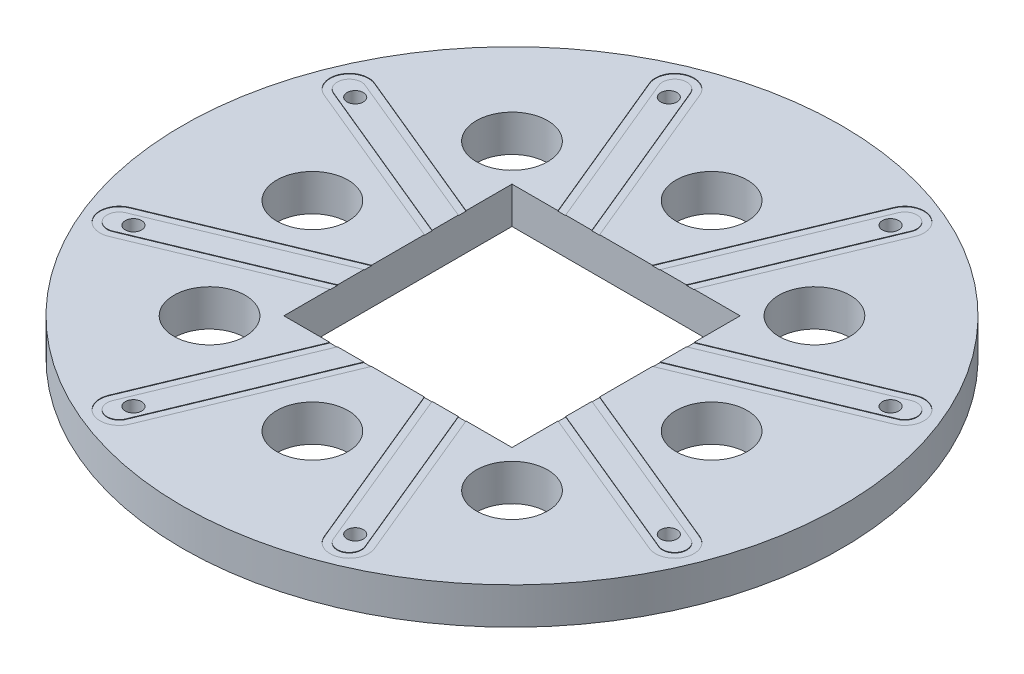
from build123d import *

# Parameters (mm, degrees)
BODAY_SKETCH_R    = 11.557
BODY_DEPTH        = 1.27
COPPER_START      = 0.017500092
COPPER_SKETCH_R   = 11.557
COPPER_DEPTH      = 0.017500092
GAP_CUT_DEPTH     = 17.39333395
CENTER_DEPTH      = 0.017500092
IO_HOLE_SKETCH_R  = 0.287000061
IO_HOLE_DEPTH     = 17.39333395
GAP_CUTS_COUNT    = 8
CENTERS_COUNT     = 8
IO_HOLES_COUNT    = 8
POCKET_DEPTH      = 17.39333395
POCKET_DEPTH_BACK = 17.39333395
POCKET_SKETCH_W   = 8.000000002
POCKET_SKETCH_H   = 8.000000002
POSTS_R           = 1.25000004
POST_CUT_DEPTH    = 17.39333395
POST_CUTS_COUNT   = 4


with BuildPart() as part:
    # Boday Sketch → Body (new body)
    with BuildSketch(Plane(origin=(0, 0, 0), x_dir=(1, 0, 0), z_dir=(0, 1, 0))):
        Circle(BODAY_SKETCH_R)
    extrude(amount=-BODY_DEPTH)

    # Copper Sketch → Copper (add)
    with BuildSketch(Plane(origin=(0, 0, 0), x_dir=(1, 0, 0), z_dir=(0, 1, 0)).offset(COPPER_START)):
        Circle(COPPER_SKETCH_R)
    extrude(amount=-COPPER_DEPTH)

    # Gap → Gap Cut (cut, through all)
    with BuildSketch(Plane(origin=(0, 0, 0), x_dir=(1, 0, 0), z_dir=(0, 1, 0))):
        with BuildLine():
            Line((0.623618728, 0.258311335), (-3.410247333, 9.996925487))
            ThreePointArc((-3.410247333, 9.996925487), (-4.292177395, 10.36223288), (-4.657484788, 9.480302817))
            Line((-4.657484788, 9.480302817), (-0.623618728, -0.258311335))
            Line((-0.623618728, -0.258311335), (0.623618728, 0.258311335))
        make_face()
    gap_cut = extrude(amount=GAP_CUT_DEPTH, mode=Mode.SUBTRACT)


with BuildPart() as body_2:
    # Center Sketch → Center (new body)
    with BuildSketch(Plane(origin=(0, 0, 0), x_dir=(1, 0, 0), z_dir=(0, 1, 0))):
        with BuildLine():
            Line((0.392648837, 0.162640474), (-3.641217223, 9.901254626))
            ThreePointArc((-3.641217223, 9.901254626), (-4.196506534, 10.13126299), (-4.426514898, 9.575973679))
            Line((-4.426514898, 9.575973679), (-0.392648837, -0.162640474))
            Line((-0.392648837, -0.162640474), (0.392648837, 0.162640474))
        make_face()
    center = extrude(amount=CENTER_DEPTH)


with BuildPart() as io_hole_tool:
    # IO Hole Sketch → IO Hole (new, symmetric)
    with BuildSketch(Plane(origin=(0, 0, 0), x_dir=(1, 0, 0), z_dir=(0, 1, 0))):
        with Locations((-3.888063673, 9.38661605)):
            Circle(IO_HOLE_SKETCH_R)
    io_hole = extrude(amount=IO_HOLE_DEPTH, both=True)


with BuildPart() as part_1:
    add(part.part)

    # IO Hole: cut by io_hole_tool
    add(io_hole_tool.part, mode=Mode.SUBTRACT)

    # Gap Cuts: Gap Cut ×8 about axis
    gap_cuts_axis = Axis((0, 0.0762, 0), (0, -1, 0))
    for i in range(1, GAP_CUTS_COUNT):
        add(gap_cut.rotate(gap_cuts_axis, i * 360 / GAP_CUTS_COUNT), mode=Mode.SUBTRACT)



with BuildPart() as body_2_1:
    add(body_2.part)

    # IO Hole: cut by io_hole_tool
    add(io_hole_tool.part, mode=Mode.SUBTRACT)


with BuildPart() as part_2:
    add(part_1.part)

    add(body_2_1.part)  # Centers merges body 2
    # Centers: Center ×8 about axis
    centers_axis = Axis((0, 0.0762, 0), (0, -1, 0))
    for i in range(1, CENTERS_COUNT):
        add(center.rotate(centers_axis, i * 360 / CENTERS_COUNT))

    # IO Holes: IO Hole ×8 about axis
    io_holes_axis = Axis((0, 0.0762, 0), (0, -1, 0))
    for i in range(1, IO_HOLES_COUNT):
        add(io_hole.rotate(io_holes_axis, i * 360 / IO_HOLES_COUNT), mode=Mode.SUBTRACT)

    # Pocket Sketch → Pocket (cut, two sides: drawn at the far end of the back side and taken through both)
    with BuildSketch(Plane(origin=(0, 0, 0), x_dir=(1, 0, 0), z_dir=(0, 1, 0)).offset(-POCKET_DEPTH_BACK)):
        Rectangle(POCKET_SKETCH_W, POCKET_SKETCH_H)
    extrude(amount=POCKET_DEPTH + POCKET_DEPTH_BACK, mode=Mode.SUBTRACT)

    # Posts → Post Cut (cut, symmetric)
    with BuildSketch(Plane(origin=(0, 0, 0), x_dir=(1, 0, 0), z_dir=(0, 1, 0))):
        with Locations((0, 6.99999997)):
            Circle(POSTS_R)
        with Locations((-5.303300849, 5.303300849)):
            Circle(POSTS_R)
    post_cut = extrude(amount=POST_CUT_DEPTH, both=True, mode=Mode.SUBTRACT)

    # Post Cuts: Post Cut ×4 about axis
    post_cuts_axis = Axis((0, 0.0762, 0), (0, -1, 0))
    for i in range(1, POST_CUTS_COUNT):
        add(post_cut.rotate(post_cuts_axis, i * 360 / POST_CUTS_COUNT), mode=Mode.SUBTRACT)


solid = part_2.part
